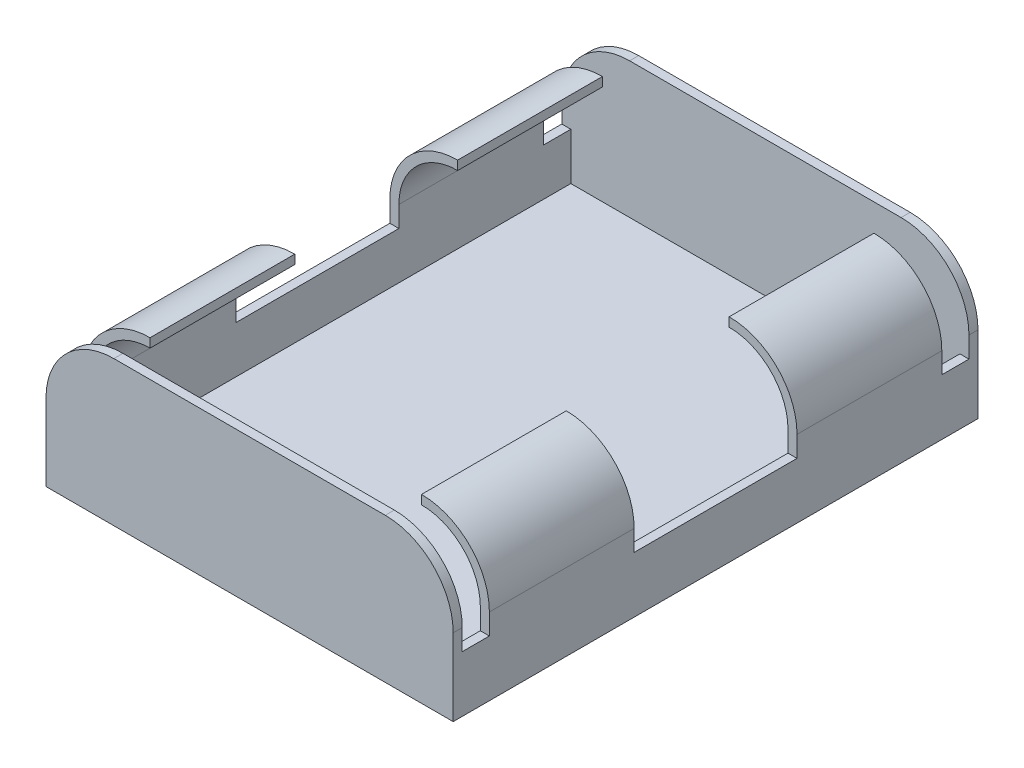
from build123d import *

# Parameters (mm, degrees)
SKETCH1_W           = 45
SKETCH1_H           = 58
BOSS_EXTRUDE1_DEPTH = 8
FILLET1_R           = 7.5
SHELL1_START        = -28
SHELL1_DEPTH        = 56
SKETCH2_W           = 18
SKETCH2_H           = 15
SKETCH2_W_2         = 3
CUT_EXTRUDE1_DEPTH  = 55.129474411
BOSS_EXTRUDE2_DEPTH = 10


# Read off the part's stored shape, not the designer's step: Shell1
with BuildPart() as part:
    # Sketch1 → Boss-Extrude1 (new, symmetric)
    with BuildSketch(Plane(origin=(0, 0, 0), x_dir=(1, 0, 0), z_dir=(0, 1, 0))):
        Rectangle(SKETCH1_W, SKETCH1_H)
    extrude(amount=BOSS_EXTRUDE1_DEPTH, both=True)

    # Fillet1
    fillet1_edges = [part.edges().sort_by_distance(p)[0] for p in [
        (22.5, 8, 0),
        (-22.5, 8, 0),
    ]]
    fillet(fillet1_edges, radius=FILLET1_R)

    # Shell1 outline → Shell1 (cut)
    with BuildSketch(Plane.XY.offset(SHELL1_START)):
        with BuildLine():
            ThreePointArc((21.5, 0.5), (19.596194078, 5.096194078), (15, 7))
            Line((15, 7), (15, 8))
            Line((15, 8), (-15, 8))
            Line((-15, 8), (-15, 7))
            ThreePointArc((-15, 7), (-19.596194078, 5.096194078), (-21.5, 0.5))
            Line((-21.5, 0.5), (-21.5, -7))
            Line((-21.5, -7), (21.5, -7))
            Line((21.5, -7), (21.5, 0.5))
        make_face()
    extrude(amount=SHELL1_DEPTH, mode=Mode.SUBTRACT)

    # Sketch2 → Cut-Extrude1 (cut, through all)
    with BuildSketch(Plane(origin=(22.5, 0, 0), x_dir=(0, 0, -1), z_dir=(1, 0, 0))):
        with Locations((0, 5.7)):
            Rectangle(SKETCH2_W, SKETCH2_H)
        with Locations((-26.5, 5.7)):
            Rectangle(SKETCH2_W_2, SKETCH2_H)
        with Locations((26.5, 5.7)):
            Rectangle(SKETCH2_W_2, SKETCH2_H)
    extrude(amount=-CUT_EXTRUDE1_DEPTH, mode=Mode.SUBTRACT)

    # Sketch3 → Boss-Extrude2 (add)
    with BuildSketch(Plane(origin=(0, 0, -29), x_dir=(-1, 0, 0), z_dir=(0, 0, -1))):
        with BuildLine():
            ThreePointArc((18.940983006, -7), (20.25, -6.5), (18.940983006, -6))
            ThreePointArc((18.940983006, -6), (17.631966011, -6.5), (18.940983006, -7))
        make_face()
    extrude(amount=BOSS_EXTRUDE2_DEPTH)


solid = part.part
